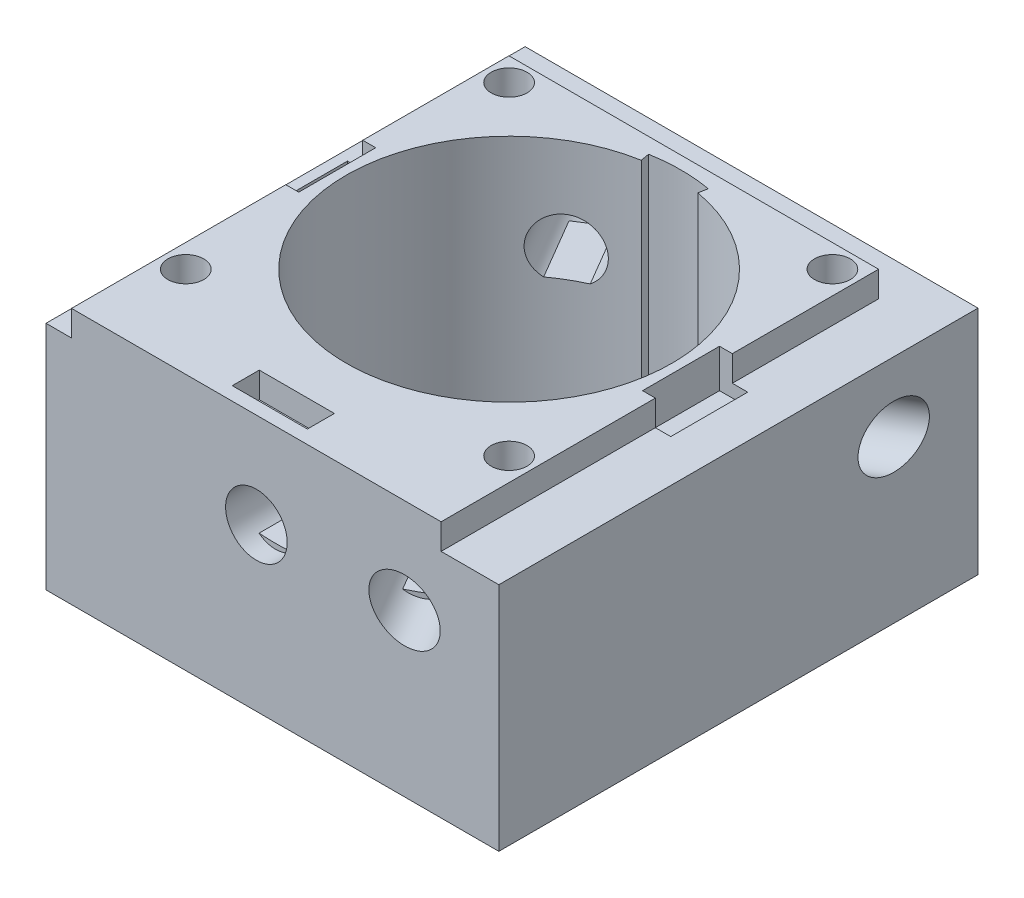
from build123d import *
from build123d.topology import SkipClean

# Parameters (mm, degrees)
SKETCH1_W                = 41.656
SKETCH1_H                = 45.847
BOSS_EXTRUDE1_DEPTH      = 25.4
SKETCH2_R                = 16.129
CUT_EXTRUDE1_DEPTH       = 25.4
SKETCH3_W                = 2.794
SKETCH3_H                = 7.62
CUT_EXTRUDE2_DEPTH       = 3.81
CUT_EXTRUDE6_START       = -25.4
CUT_EXTRUDE6_DEPTH       = 25.4
CUT_EXTRUDE7_REACH       = 58.4
CUT_EXTRUDE7_END_RADIUS  = 16.129
SKETCH7_R                = 3.048
SKETCH14_W               = 7.43654476
SKETCH14_H               = 2.672753785
SKETCH14_W_2             = 2.524584731
SKETCH14_H_2             = 43.307
CUT_EXTRUDE10_DEPTH      = 2.54
SKETCH17_W               = 45.847
SKETCH17_H               = 22.86
BOSS_EXTRUDE3_DEPTH      = 3.175
CUT_EXTRUDE12_REACH      = 43.576
SKETCH12_R               = 3.048
SKETCH18_W               = 44.831
SKETCH18_H               = 22.86
BOSS_EXTRUDE4_DEPTH      = 1.5875
CUT_EXTRUDE13_DEPTH      = 44.190833792
CUT_EXTRUDE13_DEPTH_BACK = 44.190833792
SKETCH11_R               = 3.048
BOSS_EXTRUDE8_START      = -13.462
BOSS_EXTRUDE8_DEPTH      = 1.462
SKETCH4_R                = 1.778
CUT_EXTRUDE14_DEPTH      = 43.685983001


with BuildPart() as part:
    # Sketch1 → Boss-Extrude1 (new body)
    with BuildSketch(Plane(origin=(0, 0, 0), x_dir=(1, 0, 0), z_dir=(0, 1, 0))):
        Rectangle(SKETCH1_W, SKETCH1_H)
    extrude(amount=BOSS_EXTRUDE1_DEPTH)

    # Sketch2 → Cut-Extrude1 (cut)
    with BuildSketch(Plane(origin=(0, 25.4, 0), x_dir=(1, 0, 0), z_dir=(0, 1, 0))):
        with Locations(Location((0, 2.0955, 0), (0, 0, 270))):
            Circle(SKETCH2_R)
    extrude(amount=-CUT_EXTRUDE1_DEPTH, mode=Mode.SUBTRACT)

    # Sketch3 → Cut-Extrude2 (cut)
    with BuildSketch(Plane(origin=(0, 25.4, 0), x_dir=(1, 0, 0), z_dir=(0, 1, 0))):
        with Locations((18.415, 2.0955)):
            Rectangle(SKETCH3_W, SKETCH3_H)
        with Locations((-18.415, 2.0955)):
            Rectangle(SKETCH3_W, SKETCH3_H)
    extrude(amount=-CUT_EXTRUDE2_DEPTH, mode=Mode.SUBTRACT)

    # Sketch6 → Cut-Extrude6 (cut)
    with BuildSketch(Plane(origin=(0, 25.4, 0), x_dir=(1, 0, 0), z_dir=(0, 1, 0)).offset(CUT_EXTRUDE6_START)):
        with BuildLine():
            ThreePointArc((-2.800771458, 17.979464248), (-1.405734975, 18.163124286), (0, 18.2245))
            ThreePointArc((0, 18.2245), (1.405734975, 18.163124286), (2.800771458, 17.979464248))
            Line((2.800771458, 17.979464248), (2.955144688, 18.854958341))
            ThreePointArc((2.955144688, 18.854958341), (0, 19.1135), (-2.955144688, 18.854958341))
            Line((-2.955144688, 18.854958341), (-2.800771458, 17.979464248))
        make_face()
        with BuildLine():
            Line((0, 18.2245), (0, 2.0955))
            Line((0, 2.0955), (2.800771458, 17.979464248))
            ThreePointArc((2.800771458, 17.979464248), (1.405734975, 18.163124286), (0, 18.2245))
        make_face()
        with BuildLine():
            Line((-2.800771458, 17.979464248), (0, 2.0955))
            Line((0, 2.0955), (0, 18.2245))
            ThreePointArc((0, 18.2245), (-1.405734975, 18.163124286), (-2.800771458, 17.979464248))
        make_face()
    extrude(amount=CUT_EXTRUDE6_DEPTH, mode=Mode.SUBTRACT)

    # Cut-Extrude7: up to this cylinder (the profile starts outside it)
    cut_extrude7_end = Plane(origin=(0, 16.002, -2.0955), z_dir=(0, 1, 0)) * Cylinder(CUT_EXTRUDE7_END_RADIUS, 150.058, mode=Mode.PRIVATE)
    # Sketch7 → Cut-Extrude7 (cut, up to the surface)
    with BuildSketch(Plane.XY.offset(22.9235), mode=Mode.PRIVATE) as cut_extrude7_sk1:
        with Locations((0, 16.002)):
            Circle(SKETCH7_R)
    cut_extrude7_tool1 = extrude(cut_extrude7_sk1.sketch, amount=-CUT_EXTRUDE7_REACH, mode=Mode.PRIVATE) - cut_extrude7_end
    add(cut_extrude7_tool1.solids().sort_by_distance((0, 16.002, 22.9235))[0], mode=Mode.SUBTRACT)

    # Sketch14 → Cut-Extrude10 (cut)
    with BuildSketch(Plane(origin=(0, 25.4, 0), x_dir=(1, 0, 0), z_dir=(0, 1, 0))):
        with Locations((0, -20.25731759)):
            Rectangle(SKETCH14_W, SKETCH14_H)
        Polygon((20.828, -22.9235), (20.828, 20.3835), (18.288, 20.3835), (18.288, 5.9055), (19.812, 5.9055), (19.812, -1.7145), (18.288, -1.7145), (18.288, -22.9235), align=None)
        Polygon((20.828, 22.9235), (-20.828, 22.9235), (-20.828, 20.3835), (-18.303415269, 20.3835), (18.288, 20.3835), (20.828, 20.3835), align=None)
        with Locations((-19.565707635, -1.27)):
            Rectangle(SKETCH14_W_2, SKETCH14_H_2)
    extrude(amount=-CUT_EXTRUDE10_DEPTH, mode=Mode.SUBTRACT)

    # Sketch17 → Boss-Extrude3 (add)
    with BuildSketch(Plane(origin=(20.828, 0, 0), x_dir=(0, 0, -1), z_dir=(1, 0, 0))):
        with Locations((0, 11.43)):
            Rectangle(SKETCH17_W, SKETCH17_H)
    extrude(amount=BOSS_EXTRUDE3_DEPTH)

    # Cut-Extrude12: up to this plane
    cut_extrude12_end = Plane(origin=(24.003, 0, 0), z_dir=(1, 0, 0))
    # Sketch12 → Cut-Extrude12 (cut, up to the surface)
    with BuildSketch(Plane(origin=(0.914260378, 0, -0.535980498), x_dir=(-0.50574390925612, 0, -0.862683660590797), z_dir=(0.862683660590797, 0, -0.50574390925612)), mode=Mode.PRIVATE) as cut_extrude12_sk1:
        with Locations(Location((1.807753611, 16.002, 0), (0, 0, 180))):
            Circle(SKETCH12_R)
    cut_extrude12_tool1 = split(extrude(cut_extrude12_sk1.sketch, amount=CUT_EXTRUDE12_REACH, mode=Mode.PRIVATE), bisect_by=cut_extrude12_end, keep=Keep.BOTH, mode=Mode.PRIVATE)
    add(cut_extrude12_tool1.solids().sort_by_distance((0, 16.002, -2.0955))[0], mode=Mode.SUBTRACT)

    # Sketch18 → Boss-Extrude4 (add)
    with BuildSketch(Plane(origin=(0, 0, -22.9235), x_dir=(-1, 0, 0), z_dir=(0, 0, -1))):
        with Locations((-1.5875, 11.43)):
            Rectangle(SKETCH18_W, SKETCH18_H)
    extrude(amount=BOSS_EXTRUDE4_DEPTH)

    # Sketch11 → Cut-Extrude13 (cut, two sides: drawn at the far end of the back side and taken through both)
    with BuildSketch(Plane(origin=(-0.914260378, 0, -1.559519502), x_dir=(0.862683660590797, 0, -0.50574390925612), z_dir=(0.50574390925612, 0, 0.862683660590797)).offset(-CUT_EXTRUDE13_DEPTH_BACK)):
        with Locations((1.059786362, 16.002)):
            Circle(SKETCH11_R)
    extrude(amount=CUT_EXTRUDE13_DEPTH + CUT_EXTRUDE13_DEPTH_BACK, mode=Mode.SUBTRACT)

    # Boss-Extrude8: read off the stored shape, not the designer's step
    # Boss-Extrude8 outline → Boss-Extrude8 (add)
    with SkipClean():  # the faces are left unmerged after this step: merging them gives an invalid solid
        with BuildSketch(Plane.XZ.offset(BOSS_EXTRUDE8_START)):
            with BuildLine():
                ThreePointArc((13.119762317, 16.952399563), (11.697350877, 17.857510386), (10.212785134, 18.656600154))
                Line((10.212785134, 18.656600154), (6.659027379, 12.594700658))
                ThreePointArc((6.659027379, 12.594700658), (8.157143512, 11.818724762), (9.566004562, 10.890500066))
                Line((9.566004562, 10.890500066), (13.119762317, 16.952399563))
            make_face()
            with BuildLine():
                ThreePointArc((-6.659027379, -16.785700658), (-8.157143512, -16.009724762), (-9.566004562, -15.081500066))
                Line((-9.566004562, -15.081500066), (-13.119762317, -21.143399563))
                ThreePointArc((-13.119762317, -21.143399563), (-11.697350877, -22.048510386), (-10.212785134, -22.847600154))
                Line((-10.212785134, -22.847600154), (-6.659027379, -16.785700658))
            make_face()
            with BuildLine():
                Line((20.752100154, -12.308285134), (14.690200658, -8.754527379))
                ThreePointArc((14.690200658, -8.754527379), (13.914224762, -10.252643512), (12.986000066, -11.661504562))
                Line((12.986000066, -11.661504562), (19.047899563, -15.215262317))
                ThreePointArc((19.047899563, -15.215262317), (19.953010386, -13.792850877), (20.752100154, -12.308285134))
            make_face()
            with BuildLine():
                ThreePointArc((1.684845394, 20.972051604), (0, 21.0335), (-1.684845394, 20.972051604))
                Line((-1.684845394, 20.972051604), (-1.684845394, 13.945258617))
                ThreePointArc((-1.684845394, 13.945258617), (0, 14.0335), (1.684845394, 13.945258617))
                Line((1.684845394, 13.945258617), (1.684845394, 20.972051604))
            make_face()
        extrude(amount=BOSS_EXTRUDE8_DEPTH)

    # Sketch4 → Cut-Extrude14 (cut, through all)
    with SkipClean():  # the faces are left unmerged after this step: merging them gives an invalid solid
        with BuildSketch(Plane(origin=(0, 25.4, 0), x_dir=(1, 0, 0), z_dir=(0, 1, 0))):
            with Locations(Location((-16.002, -13.9065, 0), (0, 0, 270))):
                Circle(SKETCH4_R)
            with Locations(Location((-16.002, 18.0975, 0), (0, 0, 90))):
                Circle(SKETCH4_R)
            with Locations(Location((16.002, 18.0975, 0), (0, 0, 270))):
                Circle(SKETCH4_R)
            with Locations(Location((16.002, -13.9065, 0), (0, 0, 90))):
                Circle(SKETCH4_R)
        extrude(amount=-CUT_EXTRUDE14_DEPTH, mode=Mode.SUBTRACT)


solid = part.part
